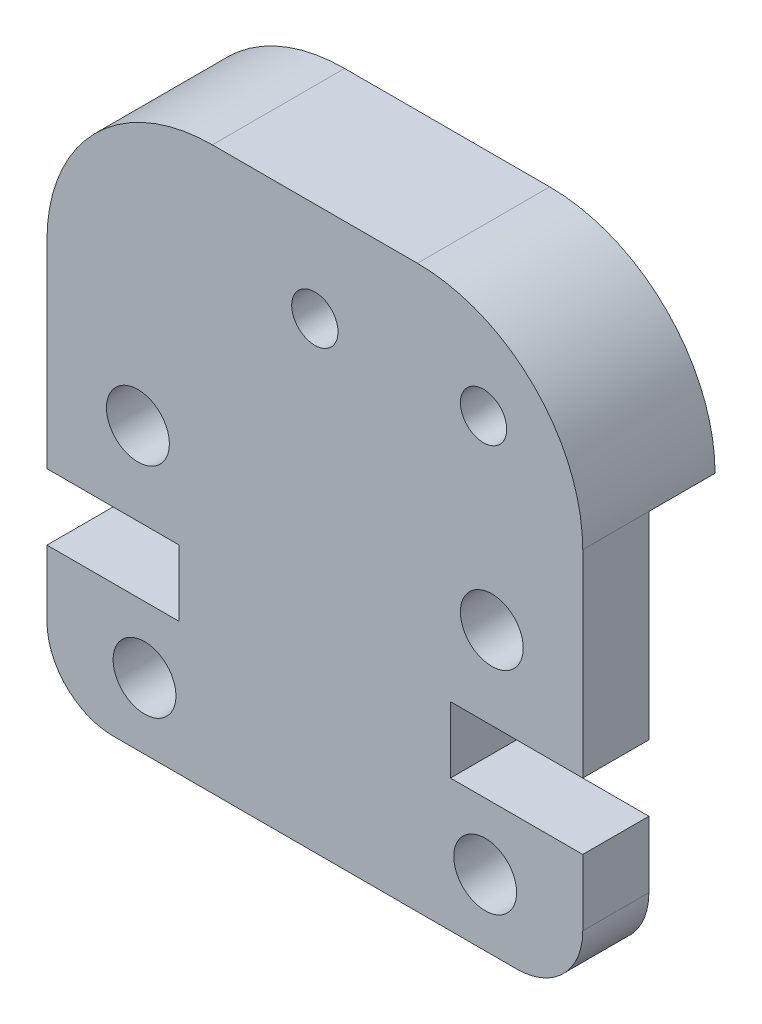
from build123d import *

# Parameters (mm, degrees)
SKETCH1_R           = 0.95
SKETCH1_R_2         = 0.7
BOSS_EXTRUDE1_DEPTH = 4
SKETCH2_W           = 16.2
SKETCH2_H           = 11.98
CUT_EXTRUDE1_DEPTH  = 2


with BuildPart() as part:
    # Sketch1 → Boss-Extrude1 (new body)
    with BuildSketch(Plane.XY):
        with BuildLine():
            Line((3.1, 16.98), (-3.1, 16.98))
            ThreePointArc((-3.1, 16.98), (-6.635533906, 15.515533906), (-8.1, 11.98))
            Line((-8.1, 11.98), (-8.1, 6))
            Line((-8.1, 6), (-4.1, 6))
            Line((-4.1, 6), (-4.1, 4))
            Line((-4.1, 4), (-8.1, 4))
            Line((-8.1, 4), (-8.1, 2))
            ThreePointArc((-8.1, 2), (-7.514213562, 0.585786438), (-6.1, 0))
            Line((-6.1, 0), (6.1, 0))
            ThreePointArc((6.1, 0), (7.514213562, 0.585786438), (8.1, 2))
            Line((8.1, 2), (8.1, 4))
            Line((8.1, 4), (4.1, 4))
            Line((4.1, 4), (4.1, 6))
            Line((4.1, 6), (8.1, 6))
            Line((8.1, 6), (8.1, 11.98))
            ThreePointArc((8.1, 11.98), (6.635533906, 15.515533906), (3.1, 16.98))
        make_face()
        with Locations((-5.15, 2)):
            Circle(SKETCH1_R, mode=Mode.SUBTRACT)
        with Locations((-5.35, 8.5)):
            Circle(SKETCH1_R, mode=Mode.SUBTRACT)
        with Locations((0, 13.98)):
            Circle(SKETCH1_R_2, mode=Mode.SUBTRACT)
        with Locations((5.35, 8.5)):
            Circle(SKETCH1_R, mode=Mode.SUBTRACT)
        with Locations((5.1, 13.98)):
            Circle(SKETCH1_R_2, mode=Mode.SUBTRACT)
        with Locations((5.15, 2)):
            Circle(SKETCH1_R, mode=Mode.SUBTRACT)
    extrude(amount=BOSS_EXTRUDE1_DEPTH)

    # Sketch2 → Cut-Extrude1 (cut)
    with BuildSketch(Plane.XY):
        with Locations((0, 5.99)):
            Rectangle(SKETCH2_W, SKETCH2_H)
    extrude(amount=CUT_EXTRUDE1_DEPTH, mode=Mode.SUBTRACT)


solid = part.part
